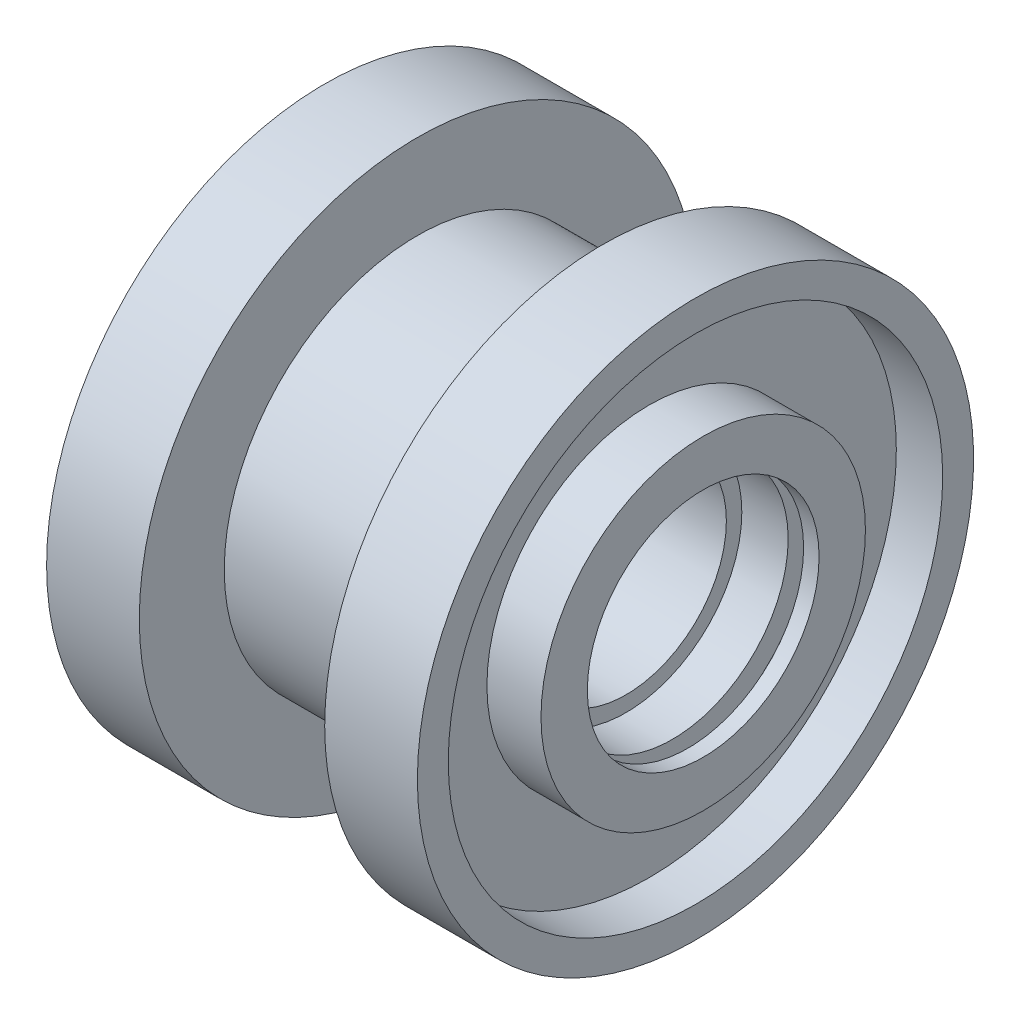
from build123d import *

# Parameters (mm, degrees)
SZKIC2_R                   = 0.5
WYTNIJ_WYCI_GNI_CIE1_DEPTH = 1


with BuildPart() as part:
    # Szkic1 → Obrót1 (revolve)
    with BuildSketch(Plane.XY):
        Polygon((-6, 12.5), (6, 12.5), (6, 18), (12, 18), (12, 16), (9, 16), (9, 10.5), (12.5, 10.5), (12.5, 7.5), (11.5, 7.5), (11.5, 8.9), (10.5, 8.9), (10.5, 7.5), (7.5, 7.5), (7.5, 6.5), (-7.5, 6.5), (-7.5, 7.5), (-10.5, 7.5), (-10.5, 8.9), (-11.5, 8.9), (-11.5, 7.5), (-12.5, 7.5), (-12.5, 10.5), (-9, 10.5), (-9, 16), (-12, 16), (-12, 18), (-6, 18), align=None)
    revolve(axis=Axis((-12.5, 0, 0), (1, 0, 0)))

    # Szkic2 → Wytnij-wyciągnięcie1 (cut)
    with BuildSketch(Plane.ZY.offset(12)):
        with Locations((0, 17)):
            Circle(SZKIC2_R)
    extrude(amount=-WYTNIJ_WYCI_GNI_CIE1_DEPTH, mode=Mode.SUBTRACT)


solid = part.part
